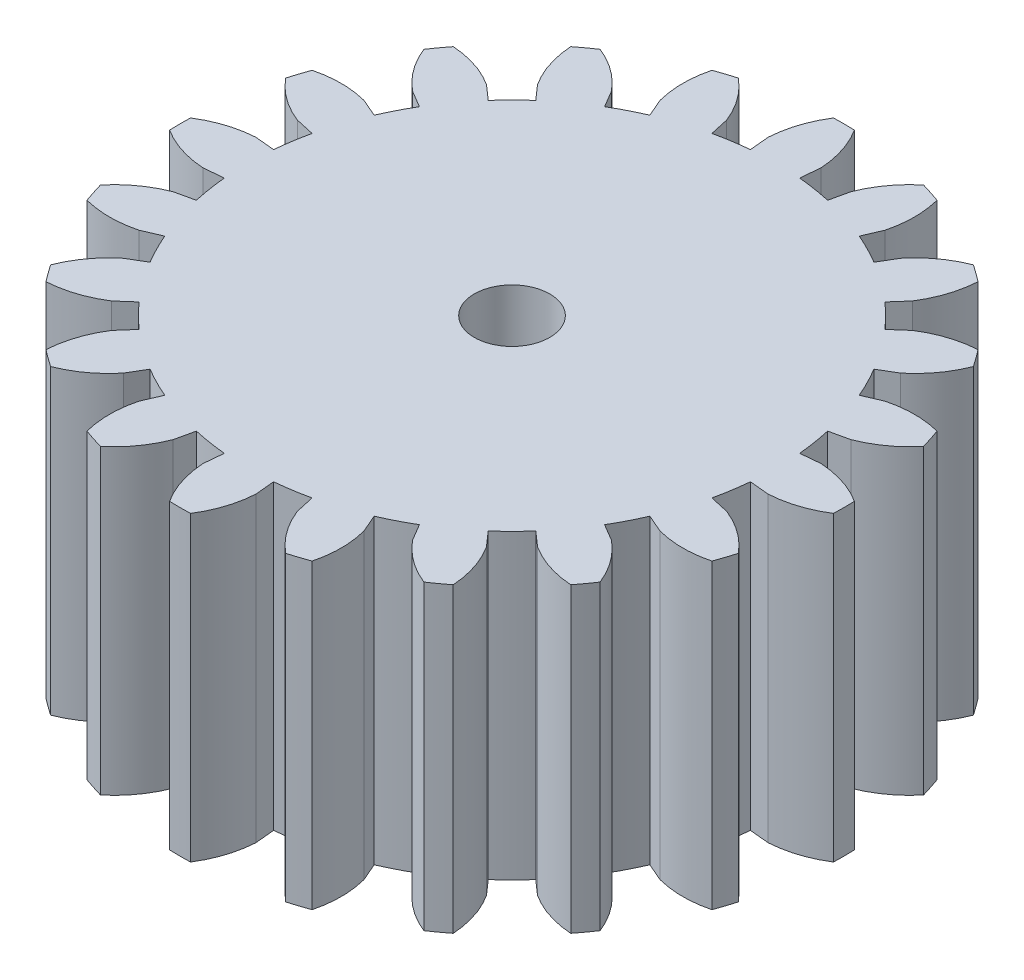
from build123d import *

# Parameters (mm, degrees)
SKETCH_1_R               = 17.5
EXTRUDE_1_DEPTH          = 20
EXTRUDE_2_DEPTH          = 20
PATTERN_CIRCULAR_1_COUNT = 20
SKETCH_3_R               = 2.5
CUT_EXTRUDE_1_DEPTH      = 37.986484018


with BuildPart() as part:
    # Эскиз1 → Бобышка-Вытянуть1 (new body)
    with BuildSketch(Plane(origin=(0, 0, 0), x_dir=(1, 0, 0), z_dir=(0, 1, 0))):
        Circle(SKETCH_1_R)
    extrude(amount=EXTRUDE_1_DEPTH)

    # Эскиз2 → Бобышка-Вытянуть2 (add)
    with BuildSketch(Plane.XZ):
        with BuildLine():
            Line((-1.631691003, 17.423764934), (-1.752328912, 18.711978549))
            ThreePointArc((-1.752328912, 18.711978549), (-1.433460227, 20.418219236), (-0.694874519, 21.989023384))
            ThreePointArc((-0.694874519, 21.989023384), (0, 22), (0.694874519, 21.989023384))
            ThreePointArc((0.694874519, 21.989023384), (1.433460227, 20.418219236), (1.752328912, 18.711978549))
            Line((1.752328912, 18.711978549), (1.631691003, 17.423764934))
            ThreePointArc((1.631691003, 17.423764934), (0, 17.5), (-1.631691003, 17.423764934))
        make_face()
    extrude_2 = extrude(amount=-EXTRUDE_2_DEPTH)

    # Круговой массив1: Бобышка-Вытянуть2 ×20 about axis
    pattern_circular_1_axis = Axis((0, 20, 0), (0, -1, 0))
    for i in range(1, PATTERN_CIRCULAR_1_COUNT):
        add(extrude_2.rotate(pattern_circular_1_axis, i * 360 / PATTERN_CIRCULAR_1_COUNT))

    # Эскиз3 → Вырез-Вытянуть1 (cut, through all)
    with BuildSketch(Plane.XZ):
        Circle(SKETCH_3_R)
    extrude(amount=-CUT_EXTRUDE_1_DEPTH, mode=Mode.SUBTRACT)


solid = part.part
